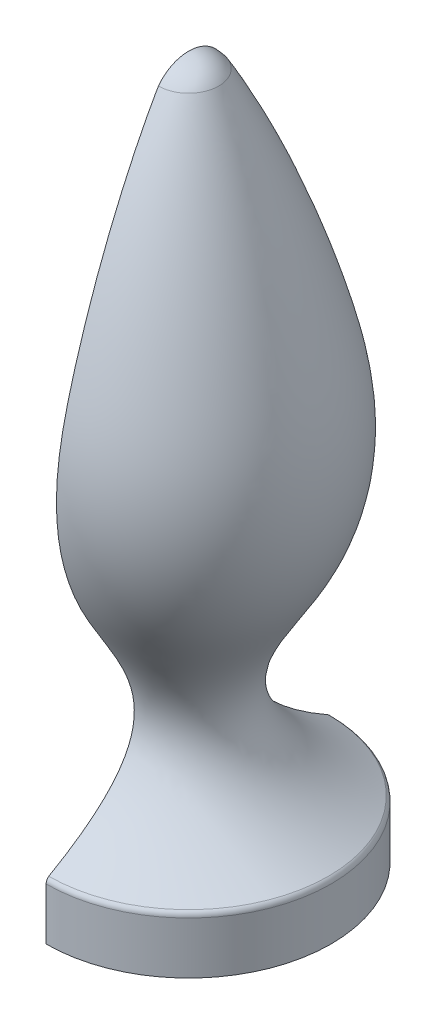
from build123d import *

# Parameters (mm, degrees)
CUT_EXTRUDE4_DEPTH      = 25.4
CUT_EXTRUDE4_DEPTH_BACK = 25.4
SKETCH8_W               = 27.315642458
SKETCH8_H               = 195.703997282


with BuildPart() as part:
    # Sketch1 → Revolve1 (revolve)
    with BuildSketch(Plane.XY):
        with BuildLine():
            Line((0, -85.725), (0, -4.583914243))
            Line((0, -4.583914243), (0, 0))
            ThreePointArc((0, 0), (2.06121182, -0.489567455), (3.682143927, -1.853697056))
            add(Edge.make_bspline(
                [(3.682143927, -1.853697056), (3.695522258, -1.874365926), (10.44578589, -12.934513447), (17.193176914, -39.152109905), (14.311259162, -56.435509768), (-0.326506217, -68.799030558), (17.073258062, -78.718040633)],
                knots=[0, 0, 0, 0, 0.440313288, 0.511581648, 0.712683597, 1, 1, 1, 1], degree=3))
            ThreePointArc((17.073258062, -78.718040633), (17.313093767, -79.008358683), (17.399, -79.375))
            Line((17.399, -79.375), (17.399, -85.725))
            Line((17.399, -85.725), (0, -85.725))
        make_face()
    revolve(axis=Axis((0, -85.725, 0), (0, 1, 0)))

    # Sketch8 → Cut-Extrude4 (cut, two sides: drawn at the far end of the back side and taken through both)
    with BuildSketch(Plane.XY.offset(-CUT_EXTRUDE4_DEPTH_BACK)):
        with Locations((-13.657821229, 0)):
            Rectangle(SKETCH8_W, SKETCH8_H)
    extrude(amount=CUT_EXTRUDE4_DEPTH + CUT_EXTRUDE4_DEPTH_BACK, mode=Mode.SUBTRACT)


solid = part.part
